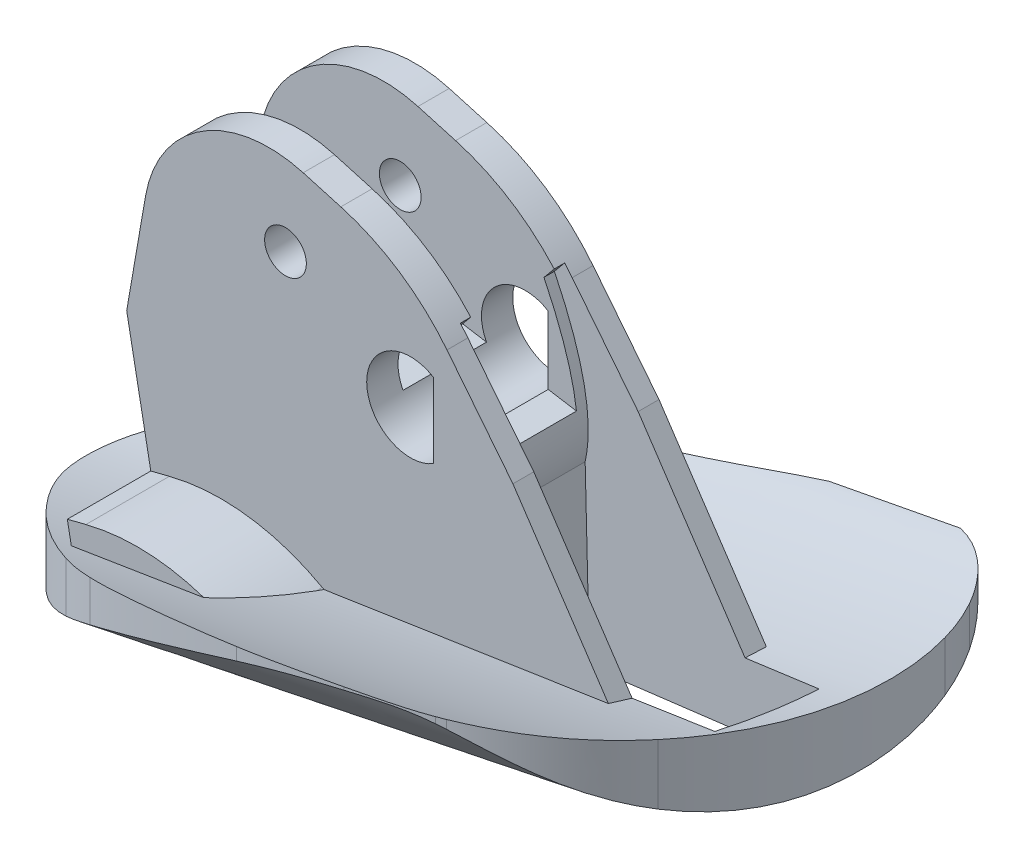
from build123d import *

# Parameters (mm, degrees)
SKETCH10_R           = 1
BOSS_EXTRUDE5_DEPTH  = 7.5
CUT_EXTRUDE1_DEPTH   = 4
FILLET1_R            = 10
CUT_EXTRUDE6_START   = -11
CUT_EXTRUDE6_DEPTH   = 10
CUT_EXTRUDE7_DEPTH   = 2
BOSS_EXTRUDE11_DEPTH = 9
SKETCH28_R           = 1
CUT_EXTRUDE8_DEPTH   = 9
CUT_EXTRUDE9_DEPTH   = 9
FILLET2_R            = 6
FILLET3_R            = 10
BOSS_EXTRUDE15_DEPTH = 2
CUT_EXTRUDE10_DEPTH  = 35
BOSS_EXTRUDE16_START = -35
BOSS_EXTRUDE16_DEPTH = 35
SKETCH37_R           = 39.300682449
CUT_EXTRUDE12_DEPTH  = 40
CUT_EXTRUDE14_DEPTH  = 2.5


# Read off the part's stored shape, not the designer's step: Boss-Extrude16
with BuildPart() as part:
    # Sketch10 → Boss-Extrude5 (new, symmetric)
    with BuildSketch(Plane.XY):
        Polygon((23.631361496, 45.435437209), (28.790605574, 38.94456176), (36.993816658, 26.682834617), (12.788755024, 23.658848526), (10.279677841, 36.875809012), (12.321789019, 48.656944563), align=None)
        with Locations((17.890076876, 43.12952492)):
            Circle(SKETCH10_R, mode=Mode.SUBTRACT)
        with BuildLine():
            Line((24.982298789, 39.668364252), (24.982298789, 41.457218634))
            ThreePointArc((24.982298789, 41.457218634), (21.782298789, 39.668364252), (24.982298789, 37.87950987))
            Line((24.982298789, 37.87950987), (24.982298789, 39.668364252))
        make_face(mode=Mode.SUBTRACT)
    extrude(amount=BOSS_EXTRUDE5_DEPTH, both=True)

    # Sketch11 → Cut-Extrude1 (cut)
    with BuildSketch(Plane.XY.offset(7.5)):
        with BuildLine():
            Line((17.825431655, 32.423947427), (9.123881611, 30.207909529))
            Line((9.123881611, 30.207909529), (6.594316119, 53.15991455))
            Line((6.594316119, 53.15991455), (34.693470887, 60.271659822))
            Line((34.693470887, 60.271659822), (37.752907488, 30.846026516))
            add(Edge.make_bspline(
                [(37.752907488, 30.846026516), (30.679137573, 30.15507536), (19.269012528, 26.734198276), (17.825431655, 32.423947427)],
                knots=[0, 0, 0, 0, 1, 1, 1, 1], degree=3))
        make_face()
    extrude(amount=-CUT_EXTRUDE1_DEPTH, mode=Mode.SUBTRACT)

    # Fillet1
    fillet1_edges = [part.edges().sort_by_distance(p)[0] for p in [
        (23.631361496, 45.435437209, -2),
    ]]
    fillet(fillet1_edges, radius=FILLET1_R)

    # Sketch11<2> → Cut-Extrude6 (cut)
    with BuildSketch(Plane.XY.offset(7.5).offset(CUT_EXTRUDE6_START)):
        with BuildLine():
            Line((17.825431655, 32.423947427), (9.123881611, 30.207909529))
            Line((9.123881611, 30.207909529), (6.594316119, 53.15991455))
            Line((6.594316119, 53.15991455), (34.693470887, 60.271659822))
            Line((34.693470887, 60.271659822), (37.752907488, 30.846026516))
            add(Edge.make_bspline(
                [(37.752907488, 30.846026516), (30.679137573, 30.15507536), (19.269012528, 26.734198276), (17.825431655, 32.423947427)],
                knots=[0, 0, 0, 0, 1, 1, 1, 1], degree=3))
        make_face()
    extrude(amount=-CUT_EXTRUDE6_DEPTH, mode=Mode.SUBTRACT)

    # Sketch16 → Cut-Extrude7 (cut, symmetric)
    with BuildSketch(Plane.XY):
        Polygon((10.074284509, 54.36084815), (34.418624568, 54.36084815), (34.418624568, 36.664364271), (10.074284509, 40.645108775), align=None)
    extrude(amount=CUT_EXTRUDE7_DEPTH, both=True, mode=Mode.SUBTRACT)

    # Sketch26 → Boss-Extrude11 (add)
    with BuildSketch(Plane(origin=(37.887458006, 25.347066677, 0), x_dir=(0, 0, -1), z_dir=(0.8311504998138468, 0.5560475219432174, 0))):
        Polygon((2, 16.359847087), (2, 14.52268859), (-2, 14.52268859), (-2, 16.359847087), (-3.5, 16.359847087), (-3.5, 6.099897416), (-7.5, 6.099897416), (-7.5, 1.607131248), (7.5, 1.607131248), (7.5, 6.099897416), (3.5, 6.099897416), (3.5, 16.359847087), align=None)
    extrude(amount=BOSS_EXTRUDE11_DEPTH)

    # Sketch28 → Cut-Extrude8 (cut)
    with BuildSketch(Plane(origin=(-0.893641348, 1.33576794, 0), x_dir=(0.8311504998138468, 0.5560475219432175, 0), z_dir=(0.5560475219432175, -0.8311504998138468, 0))):
        with Locations((38.244135106, 4.615132599)):
            Circle(SKETCH28_R)
        with Locations((38.244135106, -4.615132599)):
            Circle(SKETCH28_R)
    extrude(amount=-CUT_EXTRUDE8_DEPTH, mode=Mode.SUBTRACT)

    # Sketch32 → Cut-Extrude9 (cut)
    with BuildSketch(Plane(origin=(45.367812504, 30.351494374, 0), x_dir=(0, 0, -1), z_dir=(0.831150499813847, 0.556047521943217, 0))):
        Polygon((3.5, 16.359847087), (2, 16.359847087), (2, 14.52268859), (-2, 14.52268859), (-2, 16.359847087), (-3.5, 16.359847087), (-3.5, 6.099897416), (-7.5, 6.099897416), (-7.5, 1.607131248), (7.5, 1.607131248), (7.5, 6.099897416), (3.5, 6.099897416), align=None)
    extrude(amount=-CUT_EXTRUDE9_DEPTH, mode=Mode.SUBTRACT)

    # Fillet2
    fillet2_edges = [part.edges().sort_by_distance(p)[0] for p in [
        (12.321789019, 48.656944563, -2.75),
        (12.321789019, 48.656944563, 2.75),
    ]]
    fillet(fillet2_edges, radius=FILLET2_R)

    # Fillet3
    fillet3_edges = [part.edges().sort_by_distance(p)[0] for p in [
        (17.825431655, 32.423947427, 5.5),
        (17.825431655, 32.423947427, -5.5),
    ]]
    fillet(fillet3_edges, radius=FILLET3_R)

    # Sketch33 → Boss-Extrude15 (add)
    with BuildSketch(Plane(origin=(0, 0, -7.5), x_dir=(-1, 0, 0), z_dir=(0, 0, -1))):
        with BuildLine():
            Line((-12.788755024, 23.658848526), (-11.433819556, 30.796185182))
            Line((-11.433819556, 30.796185182), (-12.326379112, 31.023494775))
            ThreePointArc((-12.326379112, 31.023494775), (-16.080268918, 31.249787506), (-19.652288318, 30.073533078))
            add(Edge.make_bspline(
                [(-19.652288318, 30.073533078), (-22.805076593, 28.321257633), (-29.157836721, 29.598849977), (-34.495625164, 30.416999463)],
                knots=[0.191604014, 0.191604014, 0.191604014, 0.191604014, 0.85706494, 0.85706494, 0.85706494, 0.85706494], degree=3))
            Line((-34.495625164, 30.416999463), (-36.993816658, 26.682834617))
            Line((-36.993816658, 26.682834617), (-12.788755024, 23.658848526))
        make_face()
    extrude(amount=BOSS_EXTRUDE15_DEPTH)

    # Sketch34 → Cut-Extrude10 (cut)
    with BuildSketch(Plane(origin=(6.268745457, 24.499048793, 1.968665613), x_dir=(0.09229816320559835, 0.012133177357575915, 0.9956574888364383), z_dir=(-0.9871645433685716, -0.1297690232374509, 0.09309223879528124))):
        with BuildLine():
            Line((-11.064662672, 4.679129155), (-12.502072152, -3.722055904))
            Line((-12.502072152, -3.722055904), (6.704516455, -4.440039763))
            Line((6.704516455, -4.440039763), (10.696555698, -1.246339214))
            Line((10.696555698, -1.246339214), (9.136160721, 4.084710782))
            add(Edge.make_bspline(
                [(9.136160721, 4.084710782), (7.569806084, 2.339766955), (1.383050399, -2.233177183), (-6.78550733, -0.874186192), (-11.064662672, 4.679129155)],
                knots=[0, 0, 0, 0, 0, 1, 1, 1, 1, 1], degree=4))
        make_face()
    extrude(amount=-CUT_EXTRUDE10_DEPTH, mode=Mode.SUBTRACT)

    # Boss-Extrude16 outline → Boss-Extrude16 (add)
    with BuildSketch(Plane(origin=(6.268745457, 24.499048793, 1.968665613), x_dir=(0.09229816320559835, 0.012133177357575915, 0.9956574888364383), z_dir=(-0.9871645433685716, -0.1297690232374509, 0.09309223879528124)).offset(BOSS_EXTRUDE16_START)):
        with BuildLine():
            add(Edge.make_bspline(
                [(11.157448207, 6.511459403), (4.304880673, 3.231109735), (-2.207126457, 2.550750782), (-6.718765971, 2.188520136), (-10.219888377, 4.942650491), (-10.860335865, 4.552638379)],
                knots=[0, 0, 0, 0, 0, 0, 1, 1, 1, 1, 1, 1], degree=5))
            add(Edge.make_bspline(
                [(-10.860335865, 4.552638379), (-10.619553004, 4.188501221), (-10.348031777, 3.847632474), (-10.051326847, 3.529405999)],
                knots=[0, 0, 0, 0, 0.051047714, 0.051047714, 0.051047714, 0.051047714], degree=3))
            add(Edge.make_bspline(
                [(-6.634772919, 1.160018912), (-7.565383163, 1.59041001), (-8.458327216, 2.128604881), (-9.294104656, 2.776386502), (-10.051326847, 3.529405999)],
                knots=[0.789270203, 0.789270203, 0.789270203, 0.789270203, 0.789270203, 0.944732685, 0.944732685, 0.944732685, 0.944732685, 0.944732685], degree=4))
            add(Edge.make_bspline(
                [(-6.634772919, 1.160018912), (-6.286726702, 1.003213129), (-5.933009469, 0.861986766), (-5.574616184, 0.736205061)],
                knots=[0.213405328, 0.213405328, 0.213405328, 0.213405328, 0.257744043, 0.257744043, 0.257744043, 0.257744043], degree=3))
            add(Edge.make_bspline(
                [(-5.574616184, 0.736205061), (-4.912748917, 0.503916129), (-4.23493383, 0.324301689), (-3.547437694, 0.196512966)],
                knots=[0.257744043, 0.257744043, 0.257744043, 0.257744043, 0.339627117, 0.339627117, 0.339627117, 0.339627117], degree=3))
            add(Edge.make_bspline(
                [(-3.547437694, 0.196512966), (-3.222969636, 0.136202287), (-2.896345196, 0.087435405), (-2.568223167, 0.050123093)],
                knots=[0.339627117, 0.339627117, 0.339627117, 0.339627117, 0.378272341, 0.378272341, 0.378272341, 0.378272341], degree=3))
            add(Edge.make_bspline(
                [(6.463763359, 2.034537347), (4.759592498, 1.052235532), (2.526601847, 0.162524245), (-0.016885455, -0.218826454), (-2.568223167, 0.050123093)],
                knots=[0.224277652, 0.224277652, 0.224277652, 0.224277652, 0.224277652, 0.626159571, 0.626159571, 0.626159571, 0.626159571, 0.626159571], degree=4))
            add(Edge.make_bspline(
                [(6.463763359, 2.034537347), (8.329880321, 3.148463241), (9.949057242, 4.665955688), (11.157448207, 6.511459403)],
                knots=[0.745259074, 0.745259074, 0.745259074, 0.745259074, 1, 1, 1, 1], degree=3))
        make_face()
        with BuildLine():
            add(Edge.make_bspline(
                [(-6.634772919, 1.160018912), (-7.565383163, 1.59041001), (-8.458327216, 2.128604881), (-9.294104656, 2.776386502), (-10.051326832, 3.529406013)],
                knots=[0.789270203, 0.789270203, 0.789270203, 0.789270203, 0.789270203, 0.944732685, 0.944732685, 0.944732685, 0.944732685, 0.944732685], degree=4))
            add(Edge.make_bspline(
                [(-10.051326832, 3.529406013), (-9.107654715, 2.517284443), (-7.909233678, 1.734203625), (-6.634772919, 1.160018912)],
                knots=[0.051047714, 0.051047714, 0.051047714, 0.051047714, 0.213405328, 0.213405328, 0.213405328, 0.213405328], degree=3))
        make_face()
        with BuildLine():
            add(Edge.make_bspline(
                [(-2.568223167, 0.050123093), (-1.132166143, -0.113177762), (1.710484816, -0.004290738), (4.70139088, 1.047624125), (6.179937865, 1.865115718), (6.46376336, 2.034537344)],
                knots=[0.378272341, 0.378272341, 0.378272341, 0.378272341, 0.54740681, 0.706514466, 0.745259074, 0.745259074, 0.745259074, 0.745259074], degree=3))
            add(Edge.make_bspline(
                [(6.46376336, 2.034537344), (4.759592498, 1.052235532), (2.526601847, 0.162524245), (-0.016885455, -0.218826454), (-2.568223167, 0.050123093)],
                knots=[0.224277652, 0.224277652, 0.224277652, 0.224277652, 0.224277652, 0.626159571, 0.626159571, 0.626159571, 0.626159571, 0.626159571], degree=4))
        make_face()
    extrude(amount=BOSS_EXTRUDE16_DEPTH)

    # Sketch37 → Cut-Extrude12 (cut)
    with BuildSketch(Plane(origin=(0, 0, 0), x_dir=(1, 0, 0), z_dir=(0, 1, 0))):
        with Locations((26.064804662, 2.313767533)):
            Circle(SKETCH37_R)
        with BuildLine():
            Line((35.329850862, 11.404428696), (29.482048727, 10.95472316))
            add(Edge.make_bspline(
                [(29.482048727, 10.95472316), (28.911596573, 10.819106735), (28.344769077, 10.675701837), (27.208197831, 10.389299233), (26.638481464, 10.246202642), (26.064804662, 10.108531824)],
                knots=[0, 0, 0, 0, 0.5, 0.5, 1, 1, 1, 1], degree=3))
            add(Edge.make_bspline(
                [(26.064804662, 10.108531824), (25.184434287, 9.897260757), (24.294734397, 9.699931349), (22.500637932, 9.336469279), (21.594551184, 9.174145393), (20.692666762, 9.000437883)],
                knots=[0, 0, 0, 0, 0.5, 0.5, 1, 1, 1, 1], degree=3))
            add(Edge.make_bspline(
                [(20.692666762, 9.000437883), (19.97964856, 8.863106964), (19.270009996, 8.71741687), (17.878116448, 8.357166705), (17.201214047, 8.141243316), (16.534440452, 7.901662093)],
                knots=[0, 0, 0, 0, 0.5, 0.5, 1, 1, 1, 1], degree=3))
            add(Edge.make_bspline(
                [(16.534440452, 7.901662093), (15.790123551, 7.634218459), (15.058461393, 7.341978279), (13.610471294, 6.717724127), (12.89537016, 6.384970448), (11.488417818, 5.669608105), (10.796246108, 5.286428008), (9.789177112, 4.662184486), (9.458642844, 4.445445099), (8.811364409, 3.988973675), (8.494055277, 3.750036431), (8.189094922, 3.49139615)],
                knots=[0, 0, 0, 0, 0.25, 0.25, 0.5, 0.5, 0.75, 0.75, 0.875, 0.875, 1, 1, 1, 1], degree=3))
            add(Edge.make_bspline(
                [(8.189094922, 3.49139615), (7.983186398, 3.316762833), (7.784142166, 3.135119665), (7.412078524, 2.746231665), (7.240669338, 2.537541994), (7.084033011, 2.313767533)],
                knots=[0, 0, 0, 0, 0.5, 0.5, 1, 1, 1, 1], degree=3))
            add(Edge.make_bspline(
                [(7.084033011, 2.313767533), (6.972219648, 2.154028249), (6.86970762, 1.988303612), (6.682469373, 1.645020568), (6.597565349, 1.466496481), (6.374934118, 0.92243063), (6.266632068, 0.546834301), (6.168069143, -0.03763434), (6.146314061, -0.237499256), (6.125142798, -0.637892151), (6.125613445, -0.836835022), (6.15851572, -1.430080457), (6.222112593, -1.820833914), (6.329118781, -2.206670235)],
                knots=[0, 0, 0, 0, 0.125, 0.125, 0.25, 0.25, 0.5, 0.5, 0.625, 0.625, 0.75, 0.75, 1, 1, 1, 1], degree=3))
            add(Edge.make_bspline(
                [(6.329118781, -2.206670235), (6.401564685, -2.467891213), (6.492018216, -2.719287805), (6.709782046, -3.202507146), (6.837096325, -3.434336173), (6.975839414, -3.659770908)],
                knots=[0, 0, 0, 0, 0.5, 0.5, 1, 1, 1, 1], degree=3))
            add(Edge.make_bspline(
                [(6.975839414, -3.659770908), (7.15112073, -3.944574264), (7.341802921, -4.213759602), (7.740456814, -4.732717045), (7.9490018, -4.982017479), (8.596597221, -5.704914238), (9.055867731, -6.151765338), (10.008713607, -6.97855808), (10.503291508, -7.361984557), (11.515513228, -8.068116086), (12.032144096, -8.394332007), (12.564615536, -8.691324275)],
                knots=[0, 0, 0, 0, 0.125, 0.125, 0.25, 0.25, 0.5, 0.5, 0.75, 0.75, 1, 1, 1, 1], degree=3))
            add(Edge.make_bspline(
                [(12.564615536, -8.691324275), (12.880093716, -8.867285975), (13.200496657, -9.030833527), (13.86557595, -9.317261643), (14.209760808, -9.440976797), (14.563729885, -9.549408451)],
                knots=[0, 0, 0, 0, 0.5, 0.5, 1, 1, 1, 1], degree=3))
            add(Edge.make_bspline(
                [(14.563729885, -9.549408451), (15.229455154, -9.753340652), (15.917543993, -9.906647301), (17.305531972, -10.178295566), (18.005550762, -10.294756216), (19.408855303, -10.507461422), (20.112417526, -10.603094722), (21.524411356, -10.771990101), (22.232555373, -10.845838964), (22.949471017, -10.899554871)],
                knots=[0, 0, 0, 0, 0.25, 0.25, 0.5, 0.5, 0.75, 0.75, 1, 1, 1, 1], degree=3))
            add(Edge.make_bspline(
                [(22.949471017, -10.899554871), (23.787675554, -10.962358518), (24.638073929, -10.993673463), (26.364042229, -10.984253567), (27.237357635, -10.946517866), (28.110868699, -10.904803049)],
                knots=[0, 0, 0, 0, 0.5, 0.5, 1, 1, 1, 1], degree=3))
            add(Edge.make_bspline(
                [(28.110868699, -10.904803049), (28.753332828, -10.874121957), (29.397703967, -10.840715877), (30.36929278, -10.741410387), (30.696012958, -10.6991416), (31.177136141, -10.607056454), (31.336049125, -10.571552708), (31.649957435, -10.487516124), (31.805566732, -10.438595006), (31.956236653, -10.383169426)],
                knots=[0, 0, 0, 0, 0.5, 0.5, 0.75, 0.75, 0.875, 0.875, 1, 1, 1, 1], degree=3))
            add(Edge.make_bspline(
                [(31.956236653, -10.383169426), (32.084805769, -10.335873867), (32.209458837, -10.284205842), (32.331036729, -10.228876198)],
                knots=[0, 0, 0, 0, 1, 1, 1, 1], degree=3))
            add(Edge.make_bspline(
                [(32.331036729, -10.228876198), (32.632765079, -10.091560755), (32.912137563, -9.933655845), (33.435971288, -9.59016848), (33.679366819, -9.405070172), (34.139713736, -9.010582728), (34.356473958, -8.800912513), (34.761892839, -8.364200826), (34.951569479, -8.136356195), (35.490954107, -7.425651912), (35.812736404, -6.914495076), (36.408439395, -5.830866489), (36.678308285, -5.265516144), (36.928346933, -4.678408637)],
                knots=[0, 0, 0, 0, 0.125, 0.125, 0.25, 0.25, 0.375, 0.375, 0.5, 0.5, 0.75, 0.75, 1, 1, 1, 1], degree=3))
            add(Edge.make_bspline(
                [(36.928346933, -4.678408637), (37.311619799, -3.778458256), (37.643731246, -2.841375661), (38.067848628, -1.380057391), (38.196011814, -0.883412279), (38.424214677, 0.130210584), (38.524415667, 0.64790609), (38.774869189, 2.191719253), (38.880315377, 3.221629541), (38.915283712, 4.511012986), (38.917273297, 4.768998869), (38.909908404, 5.28526717), (38.900493375, 5.543693063), (38.853318194, 6.308161427), (38.797350377, 6.807156985), (38.707202236, 7.294064982)],
                knots=[0, 0, 0, 0, 0.25, 0.25, 0.375, 0.375, 0.5, 0.5, 0.75, 0.75, 0.8125, 0.8125, 0.875, 0.875, 1, 1, 1, 1], degree=3))
            add(Edge.make_bspline(
                [(38.707202236, 7.294064982), (38.597396371, 7.887148249), (38.437193879, 8.452487342), (38.188512585, 8.982270124)],
                knots=[0, 0, 0, 0, 1, 1, 1, 1], degree=3))
            add(Edge.make_bspline(
                [(38.188512585, 8.982270124), (38.051015798, 9.275188939), (37.890126569, 9.54713635), (37.520697218, 10.051313407), (37.313384361, 10.284032563), (36.834794056, 10.705171527), (36.571471798, 10.88798711), (35.985175308, 11.194913002), (35.668905923, 11.315207295), (35.329850862, 11.404428696)],
                knots=[0, 0, 0, 0, 0.25, 0.25, 0.5, 0.5, 0.75, 0.75, 1, 1, 1, 1], degree=3))
        make_face(mode=Mode.SUBTRACT)
    extrude(amount=CUT_EXTRUDE12_DEPTH, mode=Mode.SUBTRACT)

    # Sketch39 → Cut-Extrude14 (cut, symmetric)
    with BuildSketch(Plane.XY):
        with BuildLine():
            Line((26.706919372, 17.32814523), (37.466960069, 16.460400013))
            Line((37.466960069, 16.460400013), (37.466960069, 48.083011451))
            Line((37.466960069, 48.083011451), (29.187150519, 48.083011451))
            Line((29.187150519, 48.083011451), (24.778316382, 42.757563273))
            add(Edge.make_bspline(
                [(26.252705699, 35.591338382), (26.887287466, 38.428301511), (24.778316382, 42.757563273)],
                knots=[0, 0, 0, 1, 1, 1], degree=2))
            Line((26.252705699, 35.591338382), (26.706919372, 17.32814523))
        make_face()
    extrude(amount=CUT_EXTRUDE14_DEPTH, both=True, mode=Mode.SUBTRACT)


solid = part.part
